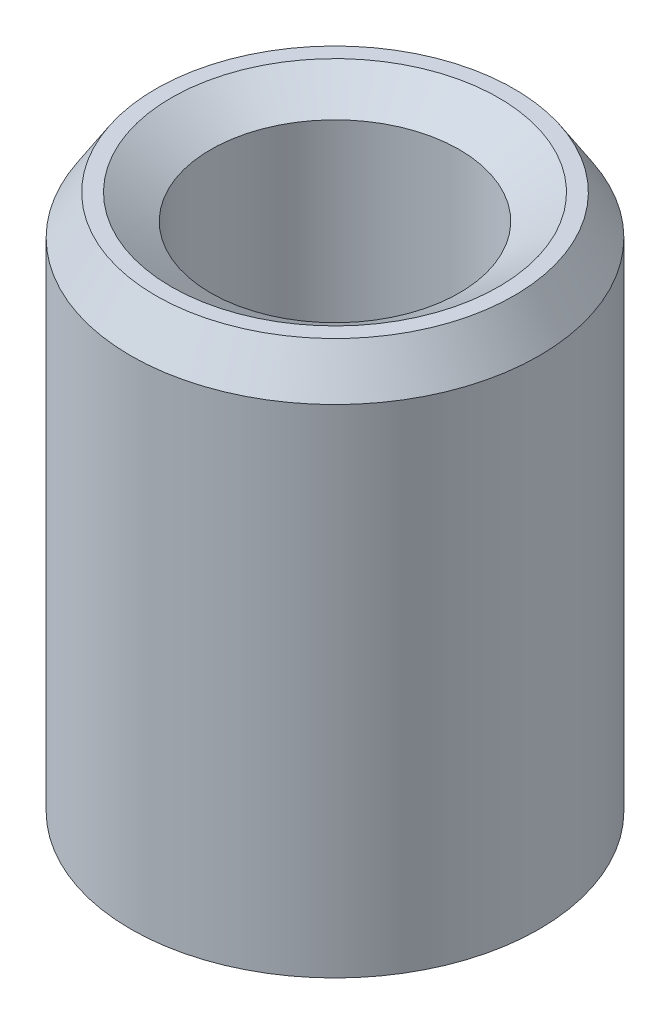
from build123d import *
from OCP.BRepFilletAPI import BRepFilletAPI_MakeChamfer

# Parameters (mm, degrees)
SKETCH1_R           = 7.5
BOSS_EXTRUDE1_DEPTH = 20.602520611
SKETCH2_R           = 4.56321453
CUT_EXTRUDE1_DEPTH  = 24.172480565
CHAMFER1_SIZE       = 1.447651216
CHAMFER1_SIZE2      = 0.921982273


with BuildPart() as part:
    # Sketch1 → Boss-Extrude1 (new body)
    with BuildSketch(Plane(origin=(0, 0, 0), x_dir=(1, 0, 0), z_dir=(0, 1, 0))):
        Circle(SKETCH1_R)
    extrude(amount=BOSS_EXTRUDE1_DEPTH)

    # Sketch2 → Cut-Extrude1 (cut, through all)
    with BuildSketch(Plane(origin=(0, 0, 0), x_dir=(1, 0, 0), z_dir=(0, 1, 0))):
        Circle(SKETCH2_R)
    extrude(amount=CUT_EXTRUDE1_DEPTH, mode=Mode.SUBTRACT)

    # Chamfer1: one chamfer whose edges measure the first distance from different faces: ONE call of the kernel's chamfer builder (chamfer() names one face for all edges)
    chamfer1_edges_1 = [part.edges().sort_by_distance(p)[0] for p in [
        (-4.56321453, 20.602520611, 0),
    ]]
    chamfer1_side_1 = [part.faces().sort_by_distance(p)[0] for p in [
        (-7.287867966, 20.602520611, 0),
    ]]
    chamfer1_edges_2 = [part.edges().sort_by_distance(p)[0] for p in [
        (-4.56321453, 0, 0),
    ]]
    chamfer1_side_2 = [part.faces().sort_by_distance(p)[0] for p in [
        (-4.56321453, 10.301260306, 0),
    ]]
    chamfer1_edges_3 = [part.edges().sort_by_distance(p)[0] for p in [
        (-7.5, 0, 0),
    ]]
    chamfer1_side_3 = [part.faces().sort_by_distance(p)[0] for p in [
        (-7.287867966, 0, 0),
    ]]
    chamfer1_edges_4 = [part.edges().sort_by_distance(p)[0] for p in [
        (-7.5, 20.602520611, 0),
    ]]
    chamfer1_side_4 = [part.faces().sort_by_distance(p)[0] for p in [
        (-7.5, 10.301260306, 0),
    ]]
    chamfer1 = BRepFilletAPI_MakeChamfer(part.part.solid().wrapped)
    for e in chamfer1_edges_1:
        chamfer1.Add(CHAMFER1_SIZE, CHAMFER1_SIZE2, e.wrapped, chamfer1_side_1[0].wrapped)  # the first distance lies on this face
    for e in chamfer1_edges_2:
        chamfer1.Add(CHAMFER1_SIZE, CHAMFER1_SIZE2, e.wrapped, chamfer1_side_2[0].wrapped)  # the first distance lies on this face
    for e in chamfer1_edges_3:
        chamfer1.Add(CHAMFER1_SIZE, CHAMFER1_SIZE2, e.wrapped, chamfer1_side_3[0].wrapped)  # the first distance lies on this face
    for e in chamfer1_edges_4:
        chamfer1.Add(CHAMFER1_SIZE, CHAMFER1_SIZE2, e.wrapped, chamfer1_side_4[0].wrapped)  # the first distance lies on this face
    add(Compound.cast(chamfer1.Shape()), mode=Mode.REPLACE)


solid = part.part
